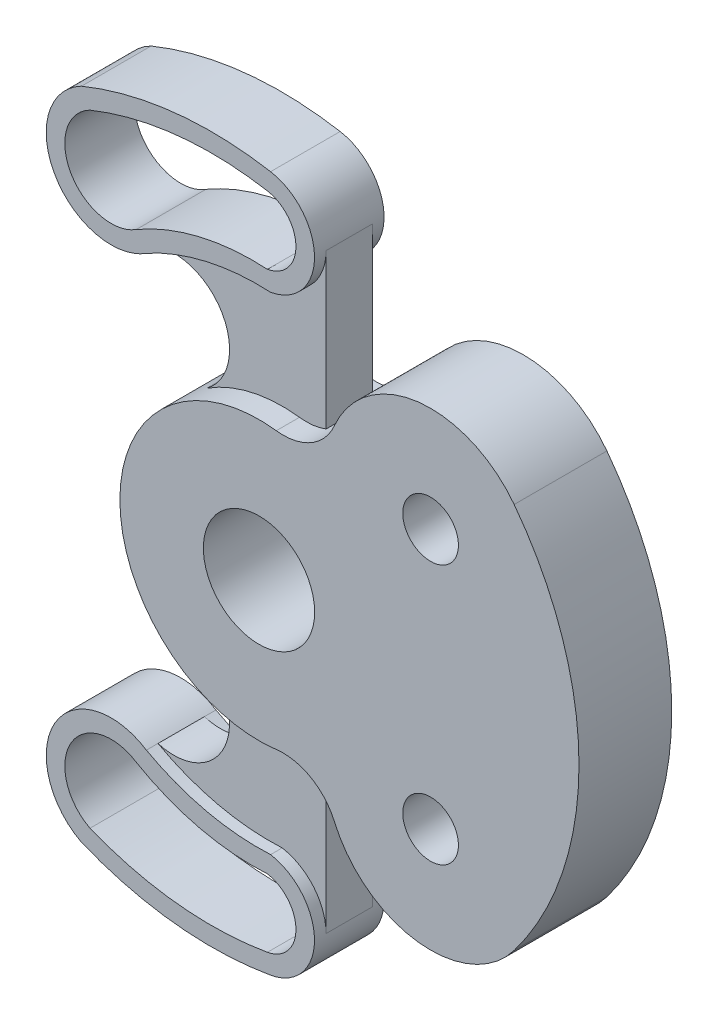
from build123d import *

# Parameters (mm, degrees)
SKETCH1_R             = 12
SKETCH1_R_2           = 6
BOSS_EXTRUDE1_DEPTH   = 20
BOSS_EXTRUDE2_DEPTH   = 7.5
BOSS_EXTRUDE2_2_DEPTH = 7.5
BOSS_EXTRUDE3_DEPTH   = 5


with BuildPart() as part:
    # Sketch1 → Boss-Extrude1 (new body)
    with BuildSketch(Plane.XY):
        with BuildLine():
            ThreePointArc((3.726717402, 29.767626331), (-30, 0), (3.726717402, -29.767626331))
            ThreePointArc((3.726717402, -29.767626331), (11.179632465, -31.260655735), (16.240407222, -36.931955285))
            ThreePointArc((16.240407222, -36.931955285), (34.277765833, -50.435016351), (55.021040607, -41.637544243))
            ThreePointArc((55.021040607, -41.637544243), (69, 0), (55.021040607, 41.637544243))
            ThreePointArc((55.021040607, 41.637544243), (34.277765833, 50.435016351), (16.240407222, 36.931955285))
            ThreePointArc((16.240407222, 36.931955285), (11.179632465, 31.260655735), (3.726717402, 29.767626331))
        make_face()
        Circle(SKETCH1_R, mode=Mode.SUBTRACT)
        with Locations((37, -28)):
            Circle(SKETCH1_R_2, mode=Mode.SUBTRACT)
        with Locations((37, 28)):
            Circle(SKETCH1_R_2, mode=Mode.SUBTRACT)
    extrude(amount=-BOSS_EXTRUDE1_DEPTH)



with BuildPart() as body_2:
    # Sketch2 → Boss-Extrude2 (new, symmetric)
    with BuildSketch(Plane.XY.offset(-10)):
        with BuildLine():
            ThreePointArc((0, 75.029338215), (-20.696071905, 75.701090057), (-40.76800111, 70.612249245))
            ThreePointArc((-40.76800111, 70.612249245), (-47.155174797, 52.434957534), (-29.342215302, 45.092723837))
            ThreePointArc((-29.342215302, 45.092723837), (-28.949505146, 45.266435927), (-28.550831211, 45.42598608))
            ThreePointArc((-28.550831211, 45.42598608), (-27.650605488, 45.877879071), (-26.78520184, 46.393330477))
            ThreePointArc((-26.78520184, 46.393330477), (-13.82075983, 51.326021178), (0, 52.507034247))
            ThreePointArc((0, 52.507034247), (9.465684914, 63.768186231), (0, 75.029338215))
        make_face()
        with BuildLine():
            ThreePointArc((-0.687840355, 71.088922545), (5.465684914, 63.768186231), (-0.687840355, 56.447449916))
            ThreePointArc((-0.687840355, 56.447449916), (-15.317913255, 55.198724707), (-28.954409532, 49.754065216))
            ThreePointArc((-28.954409532, 49.754065216), (-43.037682802, 53.155902064), (-38.942123297, 67.053292907))
            ThreePointArc((-38.942123297, 67.053292907), (-20.097629603, 71.750364494), (-0.687840355, 71.088922545))
        make_face(mode=Mode.SUBTRACT)
    extrude(amount=BOSS_EXTRUDE2_DEPTH, both=True)


with BuildPart() as body_3:
    # Sketch2 → Boss-Extrude2 2 (new, symmetric)
    with BuildSketch(Plane.XY.offset(-10)):
        with BuildLine():
            ThreePointArc((-40.76800111, -70.612249245), (-20.696071905, -75.701090057), (0, -75.029338215))
            ThreePointArc((0, -75.029338215), (9.465684914, -63.768186231), (0, -52.507034247))
            ThreePointArc((0, -52.507034247), (-13.82075983, -51.326021178), (-26.78520184, -46.393330477))
            ThreePointArc((-26.78520184, -46.393330477), (-46.501784417, -51.155902064), (-40.76800111, -70.612249245))
        make_face()
        with BuildLine():
            ThreePointArc((-0.687840355, -71.088922545), (-20.097629603, -71.750364494), (-38.942123297, -67.053292907))
            ThreePointArc((-38.942123297, -67.053292907), (-43.037682802, -53.155902064), (-28.954409532, -49.754065216))
            ThreePointArc((-28.954409532, -49.754065216), (-15.317913255, -55.198724707), (-0.687840355, -56.447449916))
            ThreePointArc((-0.687840355, -56.447449916), (5.465684914, -63.768186231), (-0.687840355, -71.088922545))
        make_face(mode=Mode.SUBTRACT)
    extrude(amount=BOSS_EXTRUDE2_2_DEPTH, both=True)


with BuildPart() as part_1:
    add(part.part)

    add(body_2.part)  # Boss-Extrude3 merges body 2

    add(body_3.part)  # Boss-Extrude3 merges body 3
    # Sketch3 → Boss-Extrude3 (add, symmetric)
    with BuildSketch(Plane.XY.offset(-10)):
        with BuildLine():
            Line((9.465684914, 30.451837991), (9.465684914, 63.768186231))
            ThreePointArc((9.465684914, 63.768186231), (6.784937065, 56.41269959), (0, 52.507034247))
            ThreePointArc((0, 52.507034247), (-13.82075983, 51.326021178), (-26.78520184, 46.393330477))
            ThreePointArc((-26.78520184, 46.393330477), (-12.59508777, 40.218032027), (-16.29220141, 25.190557223))
            ThreePointArc((-16.29220141, 25.190557223), (-6.68657143, 29.245337449), (3.726717402, 29.767626331))
            ThreePointArc((3.726717402, 29.767626331), (6.638008812, 29.759061773), (9.465684914, 30.451837991))
        make_face()
        with BuildLine():
            ThreePointArc((0, -52.507034247), (6.784937065, -56.41269959), (9.465684914, -63.768186231))
            Line((9.465684914, -63.768186231), (9.465684914, -30.451837991))
            ThreePointArc((9.465684914, -30.451837991), (6.638008812, -29.759061773), (3.726717402, -29.767626331))
            ThreePointArc((3.726717402, -29.767626331), (-6.68657143, -29.245337449), (-16.29220141, -25.190557223))
            ThreePointArc((-16.29220141, -25.190557223), (-12.59508777, -40.218032027), (-26.78520184, -46.393330477))
            ThreePointArc((-26.78520184, -46.393330477), (-13.82075983, -51.326021178), (0, -52.507034247))
        make_face()
    extrude(amount=BOSS_EXTRUDE3_DEPTH, both=True)


solid = part_1.part
